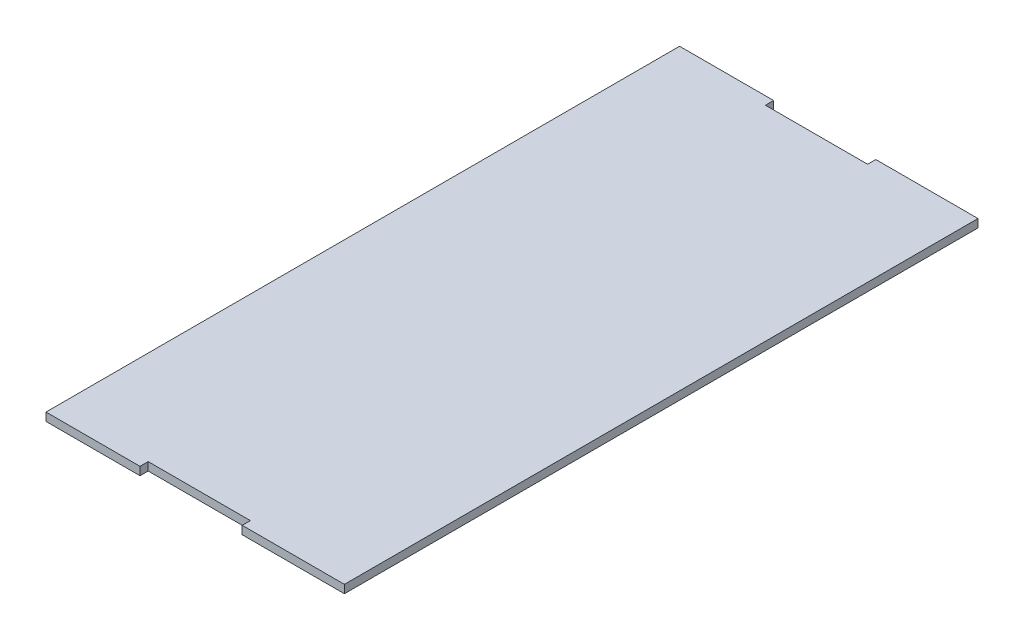
from build123d import *

# Parameters (mm, degrees)
SALIENTE_EXTRUIR1_DEPTH = 4


with BuildPart() as part:
    # Croquis1 → Saliente-Extruir1 (new body)
    with BuildSketch(Plane(origin=(0, 0, 0), x_dir=(1, 0, 0), z_dir=(0, 1, 0))):
        Polygon((-50, 155), (-100, 155), (-100, 151), (-150, 151), (-150, 155), (-196, 155), (-196, -155), (-150, -155), (-150, -151), (-100, -151), (-100, -155), (-50, -155), align=None)
    extrude(amount=SALIENTE_EXTRUIR1_DEPTH)


solid = part.part
